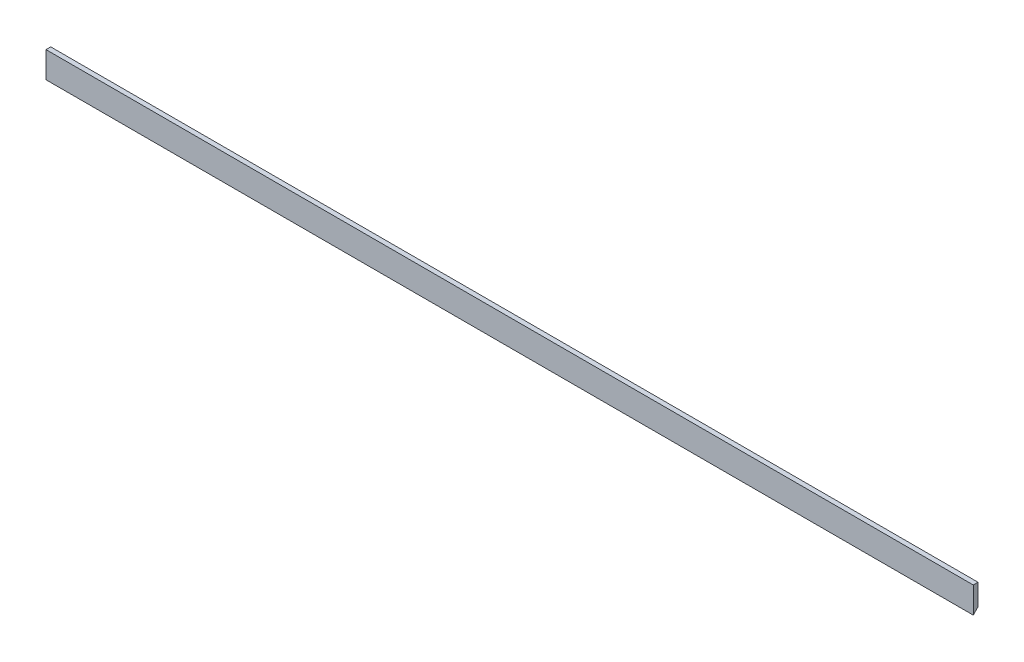
from build123d import *

# Parameters (mm, degrees)
SKETCH1_W           = 3.175
SKETCH1_H           = 17.5
BOSS_EXTRUDE1_DEPTH = 310.5
CHAMFER1_SIZE       = 3.175


with BuildPart() as part:
    # Sketch1 → Boss-Extrude1 (new, symmetric)
    with BuildSketch(Plane(origin=(0, 0, 0), x_dir=(0, 0, -1), z_dir=(1, 0, 0))):
        Rectangle(SKETCH1_W, SKETCH1_H)
    extrude(amount=BOSS_EXTRUDE1_DEPTH, both=True)

    # Chamfer1
    chamfer1_edges = [part.edges().sort_by_distance(p)[0] for p in [
        (0, -8.75, -1.5875),
    ]]
    chamfer(chamfer1_edges, length=CHAMFER1_SIZE - 0.0001)  # a hair under: the kernel refuses the full size


solid = part.part
